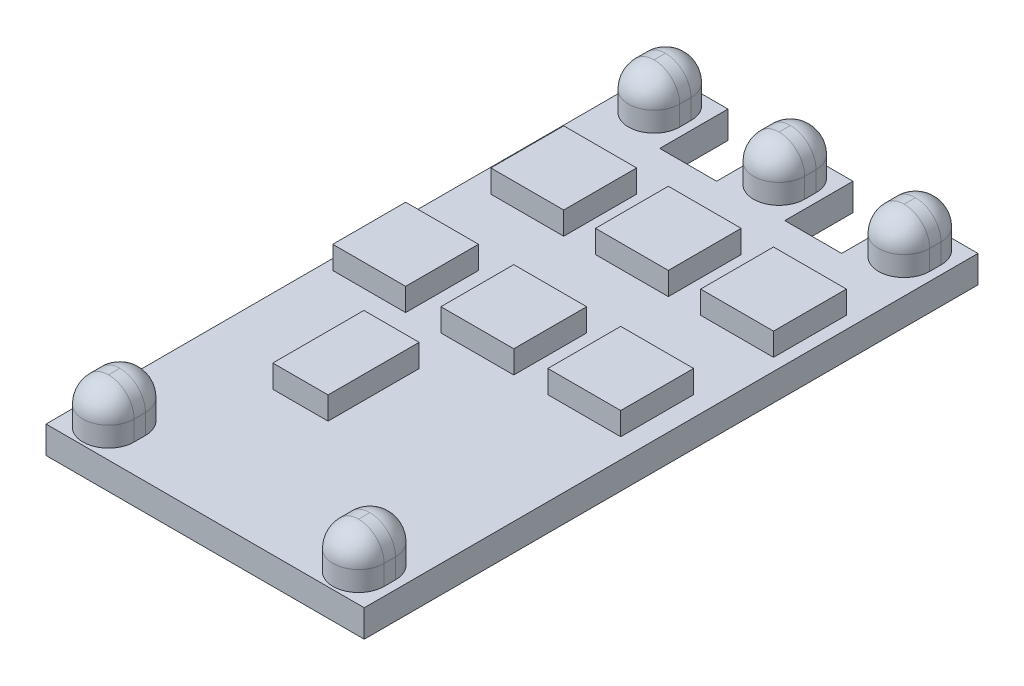
from build123d import *

# Parameters (mm, degrees)
SKETCH1_W               = 14
SKETCH1_H               = 24
SKETCH1_W_2             = 3
SKETCH1_H_2             = 3
PCB_DEPTH               = 1.2
SOLDER_JOINTS_DEPTH     = 2
SOLDER_FILLETS_R        = 1.125
SKETCH2_W               = 3.205722041
SKETCH2_H               = 3.205722042
SKETCH2_W_2             = 3.205722042
SKETCH2_W_3             = 2.430144128
SKETCH2_H_2             = 4.007152552
TOP_COMPONENTS_DEPTH    = 1
SKETCH3_W               = 4.033005149
SKETCH3_H               = 4.058308378
SKETCH3_W_2             = 3.102311653
SKETCH3_H_2             = 2.921343474
SKETCH3_W_3             = 2.817933085
SKETCH3_W_4             = 2.869638279
SKETCH3_W_5             = 1.835534395
SKETCH3_H_3             = 3.12816425
BOTTOM_COMPONENTS_DEPTH = 1


with BuildPart() as part:
    # Sketch1 → PCB (new body)
    with BuildSketch(Plane(origin=(0, 0, 0), x_dir=(1, 0, 0), z_dir=(0, 1, 0))):
        Rectangle(SKETCH1_W, SKETCH1_H)
        with Locations((-5.5, 13.5)):
            Rectangle(SKETCH1_W_2, SKETCH1_H_2)
        with Locations((0, 13.5)):
            Rectangle(SKETCH1_W_2, SKETCH1_H_2)
        with Locations((5.5, 13.5)):
            Rectangle(SKETCH1_W_2, SKETCH1_H_2)
    extrude(amount=PCB_DEPTH)

    # Sketch5 → Solder joints (add)
    with BuildSketch(Plane(origin=(0, 1.2, 0), x_dir=(1, 0, 0), z_dir=(0, 1, 0))):
        with BuildLine():
            Line((-4.375, 13.25), (-4.375, 13.75))
            ThreePointArc((-4.375, 13.75), (-5.5, 14.875), (-6.625, 13.75))
            Line((-6.625, 13.75), (-6.625, 13.25))
            ThreePointArc((-6.625, 13.25), (-5.5, 12.125), (-4.375, 13.25))
        make_face()
        with BuildLine():
            Line((-1.125, 13.75), (-1.125, 13.25))
            ThreePointArc((-1.125, 13.25), (0, 12.125), (1.125, 13.25))
            Line((1.125, 13.25), (1.125, 13.75))
            ThreePointArc((1.125, 13.75), (0, 14.875), (-1.125, 13.75))
        make_face()
        with BuildLine():
            Line((4.375, 13.75), (4.375, 13.25))
            ThreePointArc((4.375, 13.25), (5.5, 12.125), (6.625, 13.25))
            Line((6.625, 13.25), (6.625, 13.75))
            ThreePointArc((6.625, 13.75), (5.5, 14.875), (4.375, 13.75))
        make_face()
        with BuildLine():
            Line((-6.625, -10.25), (-6.625, -10.75))
            ThreePointArc((-6.625, -10.75), (-5.5, -11.875), (-4.375, -10.75))
            Line((-4.375, -10.75), (-4.375, -10.25))
            ThreePointArc((-4.375, -10.25), (-5.5, -9.125), (-6.625, -10.25))
        make_face()
        with BuildLine():
            ThreePointArc((6.625, -10.75), (5.5, -11.875), (4.375, -10.75))
            Line((4.375, -10.75), (4.375, -10.25))
            ThreePointArc((4.375, -10.25), (5.5, -9.125), (6.625, -10.25))
            Line((6.625, -10.25), (6.625, -10.75))
        make_face()
    extrude(amount=SOLDER_JOINTS_DEPTH)

    # Solder fillets
    solder_fillets_edges = [part.edges().sort_by_distance(p)[0] for p in [
        (-6.625, 3.2, -13.5),
        (-4.375, 3.2, -13.5),
        (-5.5, 3.2, -14.875),
        (-5.5, 3.2, -12.125),
        (1.125, 3.2, -13.5),
        (-1.125, 3.2, -13.5),
        (0, 3.2, -12.125),
        (0, 3.2, -14.875),
        (6.625, 3.2, -13.5),
        (4.375, 3.2, -13.5),
        (5.5, 3.2, -12.125),
        (5.5, 3.2, -14.875),
        (-4.375, 3.2, 10.5),
        (-6.625, 3.2, 10.5),
        (-5.5, 3.2, 11.875),
        (-5.5, 3.2, 9.125),
        (5.5, 3.2, 11.875),
        (6.625, 3.2, 10.5),
        (5.5, 3.2, 9.125),
        (4.375, 3.2, 10.5),
    ]]
    fillet(solder_fillets_edges, radius=SOLDER_FILLETS_R - 0.0001)  # a hair under: the kernel refuses the full size

    # Sketch2 → Top components (add)
    with BuildSketch(Plane(origin=(0, 1.2, 0), x_dir=(1, 0, 0), z_dir=(0, 1, 0))):
        with Locations((-4.369088912, 8.144117457)):
            Rectangle(SKETCH2_W, SKETCH2_H)
        with Locations((0.232673374, 8.144117457)):
            Rectangle(SKETCH2_W_2, SKETCH2_H)
        with Locations((4.860288257, 8.144117457)):
            Rectangle(SKETCH2_W, SKETCH2_H)
        with Locations((-4.937846048, 1.758525971)):
            Rectangle(SKETCH2_W_2, SKETCH2_H)
        with Locations((-0.18096818, 1.758525971)):
            Rectangle(SKETCH2_W_2, SKETCH2_H)
        with Locations((4.524204494, 1.758525971)):
            Rectangle(SKETCH2_W_2, SKETCH2_H)
        with Locations((-2.119912963, -3.68344572)):
            Rectangle(SKETCH2_W_3, SKETCH2_H_2)
    extrude(amount=TOP_COMPONENTS_DEPTH)

    # Sketch3 → Bottom components (add)
    with BuildSketch(Plane.XZ):
        with Locations((-0.775577914, 2.029154189)):
            Rectangle(SKETCH3_W, SKETCH3_H)
        with Locations((-4.343236315, -5.442521059)):
            Rectangle(SKETCH3_W_2, SKETCH3_H_2)
        with Locations((0.090484089, -5.442521059)):
            Rectangle(SKETCH3_W_3, SKETCH3_H_2)
        with Locations((4.511278196, -5.442521059)):
            Rectangle(SKETCH3_W_4, SKETCH3_H_2)
        with Locations((4.433720405, 7.923271646)):
            Rectangle(SKETCH3_W_5, SKETCH3_H_3)
    extrude(amount=BOTTOM_COMPONENTS_DEPTH)


solid = part.part
